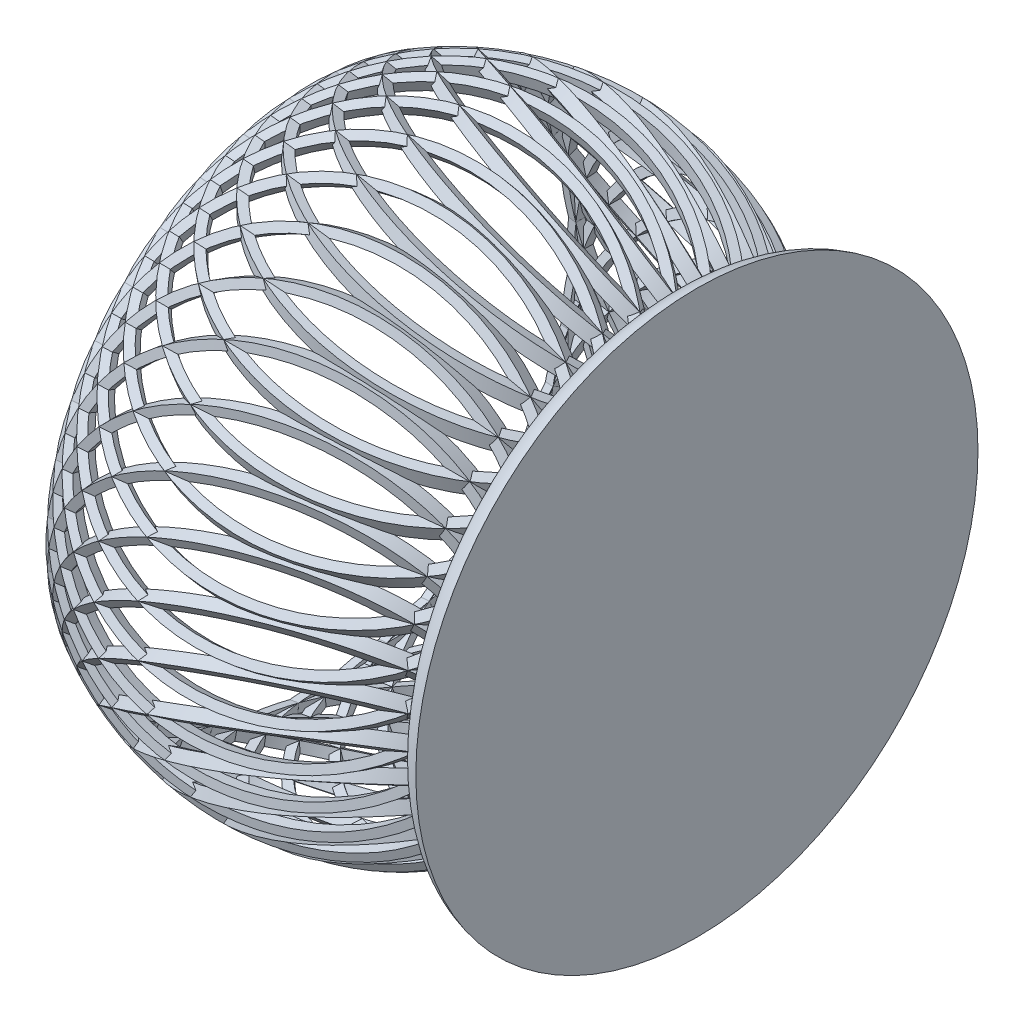
from build123d import *

# Parameters (mm, degrees)
SKETCH1_R               = 42
SKETCH1_R_2             = 40
EXTRUDE_THIN1_DEPTH     = 120
CUT_EXTRUDE1_DEPTH      = 134.895481627
CUT_EXTRUDE1_DEPTH_BACK = 134.895481627
SKETCH3_OUTSIDE_W       = 119.77
SKETCH3_OUTSIDE_H       = 155.77
CIRPATTERN1_COUNT       = 4
CIRPATTERN2_COUNT       = 9


with BuildPart() as part:
    # Sketch1 → Extrude-Thin1 (new body)
    with BuildSketch(Plane.XY):
        Circle(SKETCH1_R)
        Circle(SKETCH1_R_2, mode=Mode.SUBTRACT)
    extrude(amount=-EXTRUDE_THIN1_DEPTH)

    # Sketch3 outside → Cut-Extrude1 (cut, two sides: drawn at the far end of the back side and taken through both)
    with BuildSketch(Plane(origin=(0, 0, 0), x_dir=(1, 0, 0), z_dir=(0, 1, 0)).offset(-CUT_EXTRUDE1_DEPTH_BACK)):
        with Locations((0, 60)):
            Rectangle(SKETCH3_OUTSIDE_W, SKETCH3_OUTSIDE_H)
        with BuildLine():
            Line((-42, 62), (-42, 60))
            ThreePointArc((-42, 60), (1.240488938, 49.837575246), (42, 32.183198497))
            Line((42, 32.183198497), (42, 35.183198497))
            ThreePointArc((42, 35.183198497), (1.297146101, 52.654733789), (-42, 62))
        make_face(mode=Mode.SUBTRACT)
    extrude(amount=CUT_EXTRUDE1_DEPTH + CUT_EXTRUDE1_DEPTH_BACK, mode=Mode.SUBTRACT)


with BuildPart() as cirpattern1_1:
    # CirPattern1: pattern copy
    add(part.part.rotate(Axis((0, 0, 0), (-1, 0, 0)), 1 * 360 / CIRPATTERN1_COUNT))


with BuildPart() as cirpattern1_2:
    # CirPattern1: pattern copy
    add(part.part.rotate(Axis((0, 0, 0), (-1, 0, 0)), 2 * 360 / CIRPATTERN1_COUNT))


with BuildPart() as cirpattern1_3:
    # CirPattern1: pattern copy
    add(part.part.rotate(Axis((0, 0, 0), (-1, 0, 0)), 3 * 360 / CIRPATTERN1_COUNT))


with BuildPart() as cirpattern2_1:
    # CirPattern2: pattern copy
    add(part.part.rotate(Axis((0, 0, 0), (-1, 0, 0)), 1 * 360 / CIRPATTERN2_COUNT))


with BuildPart() as cirpattern2_2:
    # CirPattern2: pattern copy
    add(part.part.rotate(Axis((0, 0, 0), (-1, 0, 0)), 2 * 360 / CIRPATTERN2_COUNT))


with BuildPart() as cirpattern2_3:
    # CirPattern2: pattern copy
    add(part.part.rotate(Axis((0, 0, 0), (-1, 0, 0)), 3 * 360 / CIRPATTERN2_COUNT))


with BuildPart() as cirpattern2_4:
    # CirPattern2: pattern copy
    add(part.part.rotate(Axis((0, 0, 0), (-1, 0, 0)), 4 * 360 / CIRPATTERN2_COUNT))


with BuildPart() as cirpattern2_5:
    # CirPattern2: pattern copy
    add(part.part.rotate(Axis((0, 0, 0), (-1, 0, 0)), 5 * 360 / CIRPATTERN2_COUNT))


with BuildPart() as cirpattern2_6:
    # CirPattern2: pattern copy
    add(part.part.rotate(Axis((0, 0, 0), (-1, 0, 0)), 6 * 360 / CIRPATTERN2_COUNT))


with BuildPart() as cirpattern2_7:
    # CirPattern2: pattern copy
    add(part.part.rotate(Axis((0, 0, 0), (-1, 0, 0)), 7 * 360 / CIRPATTERN2_COUNT))


with BuildPart() as cirpattern2_8:
    # CirPattern2: pattern copy
    add(part.part.rotate(Axis((0, 0, 0), (-1, 0, 0)), 8 * 360 / CIRPATTERN2_COUNT))


with BuildPart() as cirpattern2_9:
    # CirPattern2: pattern copy
    add(cirpattern1_1.part.rotate(Axis((0, 0, 0), (-1, 0, 0)), 1 * 360 / CIRPATTERN2_COUNT))


with BuildPart() as cirpattern2_10:
    # CirPattern2: pattern copy
    add(cirpattern1_1.part.rotate(Axis((0, 0, 0), (-1, 0, 0)), 2 * 360 / CIRPATTERN2_COUNT))


with BuildPart() as cirpattern2_11:
    # CirPattern2: pattern copy
    add(cirpattern1_1.part.rotate(Axis((0, 0, 0), (-1, 0, 0)), 3 * 360 / CIRPATTERN2_COUNT))


with BuildPart() as cirpattern2_12:
    # CirPattern2: pattern copy
    add(cirpattern1_1.part.rotate(Axis((0, 0, 0), (-1, 0, 0)), 4 * 360 / CIRPATTERN2_COUNT))


with BuildPart() as cirpattern2_13:
    # CirPattern2: pattern copy
    add(cirpattern1_1.part.rotate(Axis((0, 0, 0), (-1, 0, 0)), 5 * 360 / CIRPATTERN2_COUNT))


with BuildPart() as cirpattern2_14:
    # CirPattern2: pattern copy
    add(cirpattern1_1.part.rotate(Axis((0, 0, 0), (-1, 0, 0)), 6 * 360 / CIRPATTERN2_COUNT))


with BuildPart() as cirpattern2_15:
    # CirPattern2: pattern copy
    add(cirpattern1_1.part.rotate(Axis((0, 0, 0), (-1, 0, 0)), 7 * 360 / CIRPATTERN2_COUNT))


with BuildPart() as cirpattern2_16:
    # CirPattern2: pattern copy
    add(cirpattern1_1.part.rotate(Axis((0, 0, 0), (-1, 0, 0)), 8 * 360 / CIRPATTERN2_COUNT))


with BuildPart() as cirpattern2_17:
    # CirPattern2: pattern copy
    add(cirpattern1_2.part.rotate(Axis((0, 0, 0), (-1, 0, 0)), 1 * 360 / CIRPATTERN2_COUNT))


with BuildPart() as cirpattern2_18:
    # CirPattern2: pattern copy
    add(cirpattern1_2.part.rotate(Axis((0, 0, 0), (-1, 0, 0)), 2 * 360 / CIRPATTERN2_COUNT))


with BuildPart() as cirpattern2_19:
    # CirPattern2: pattern copy
    add(cirpattern1_2.part.rotate(Axis((0, 0, 0), (-1, 0, 0)), 3 * 360 / CIRPATTERN2_COUNT))


with BuildPart() as cirpattern2_20:
    # CirPattern2: pattern copy
    add(cirpattern1_2.part.rotate(Axis((0, 0, 0), (-1, 0, 0)), 4 * 360 / CIRPATTERN2_COUNT))


with BuildPart() as cirpattern2_21:
    # CirPattern2: pattern copy
    add(cirpattern1_2.part.rotate(Axis((0, 0, 0), (-1, 0, 0)), 5 * 360 / CIRPATTERN2_COUNT))


with BuildPart() as cirpattern2_22:
    # CirPattern2: pattern copy
    add(cirpattern1_2.part.rotate(Axis((0, 0, 0), (-1, 0, 0)), 6 * 360 / CIRPATTERN2_COUNT))


with BuildPart() as cirpattern2_23:
    # CirPattern2: pattern copy
    add(cirpattern1_2.part.rotate(Axis((0, 0, 0), (-1, 0, 0)), 7 * 360 / CIRPATTERN2_COUNT))


with BuildPart() as cirpattern2_24:
    # CirPattern2: pattern copy
    add(cirpattern1_2.part.rotate(Axis((0, 0, 0), (-1, 0, 0)), 8 * 360 / CIRPATTERN2_COUNT))


with BuildPart() as cirpattern2_25:
    # CirPattern2: pattern copy
    add(cirpattern1_3.part.rotate(Axis((0, 0, 0), (-1, 0, 0)), 1 * 360 / CIRPATTERN2_COUNT))


with BuildPart() as cirpattern2_26:
    # CirPattern2: pattern copy
    add(cirpattern1_3.part.rotate(Axis((0, 0, 0), (-1, 0, 0)), 2 * 360 / CIRPATTERN2_COUNT))


with BuildPart() as cirpattern2_27:
    # CirPattern2: pattern copy
    add(cirpattern1_3.part.rotate(Axis((0, 0, 0), (-1, 0, 0)), 3 * 360 / CIRPATTERN2_COUNT))


with BuildPart() as cirpattern2_28:
    # CirPattern2: pattern copy
    add(cirpattern1_3.part.rotate(Axis((0, 0, 0), (-1, 0, 0)), 4 * 360 / CIRPATTERN2_COUNT))


with BuildPart() as cirpattern2_29:
    # CirPattern2: pattern copy
    add(cirpattern1_3.part.rotate(Axis((0, 0, 0), (-1, 0, 0)), 5 * 360 / CIRPATTERN2_COUNT))


with BuildPart() as cirpattern2_30:
    # CirPattern2: pattern copy
    add(cirpattern1_3.part.rotate(Axis((0, 0, 0), (-1, 0, 0)), 6 * 360 / CIRPATTERN2_COUNT))


with BuildPart() as cirpattern2_31:
    # CirPattern2: pattern copy
    add(cirpattern1_3.part.rotate(Axis((0, 0, 0), (-1, 0, 0)), 7 * 360 / CIRPATTERN2_COUNT))


with BuildPart() as cirpattern2_32:
    # CirPattern2: pattern copy
    add(cirpattern1_3.part.rotate(Axis((0, 0, 0), (-1, 0, 0)), 8 * 360 / CIRPATTERN2_COUNT))


with BuildPart() as body_37:
    # Sketch5 → Revolve1 (revolve)
    with BuildSketch(Plane(origin=(0, 0, 0), x_dir=(1, 0, 0), z_dir=(0, 1, 0))):
        with BuildLine():
            Line((42, 0), (42, 56.446742019))
            ThreePointArc((42, 56.446742019), (43.230707111, 62.417235597), (48.32272495, 65.76877075))
            Line((48.32272495, 65.76877075), (48.32272495, 0))
            Line((48.32272495, 0), (42, 0))
        make_face()
    revolve(axis=Axis((42, 0, 0), (-1, 0, 0)))


solid = Compound([part.part, cirpattern1_1.part, cirpattern1_2.part, cirpattern1_3.part, cirpattern2_1.part, cirpattern2_2.part, cirpattern2_3.part, cirpattern2_4.part, cirpattern2_5.part, cirpattern2_6.part, cirpattern2_7.part, cirpattern2_8.part, cirpattern2_9.part, cirpattern2_10.part, cirpattern2_11.part, cirpattern2_12.part, cirpattern2_13.part, cirpattern2_14.part, cirpattern2_15.part, cirpattern2_16.part, cirpattern2_17.part, cirpattern2_18.part, cirpattern2_19.part, cirpattern2_20.part, cirpattern2_21.part, cirpattern2_22.part, cirpattern2_23.part, cirpattern2_24.part, cirpattern2_25.part, cirpattern2_26.part, cirpattern2_27.part, cirpattern2_28.part, cirpattern2_29.part, cirpattern2_30.part, cirpattern2_31.part, cirpattern2_32.part, body_37.part])
